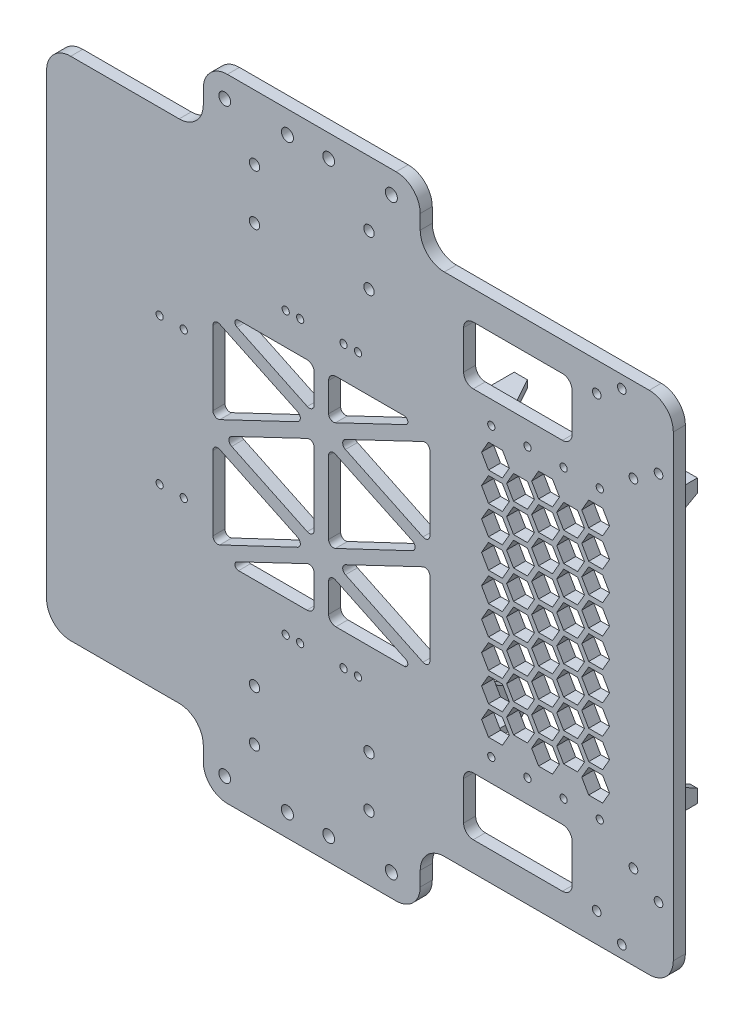
from build123d import *

# Parameters (mm, degrees)
EXTRUDE_1_DEPTH       = 5
EXTRUDE_2_DEPTH       = 20
CUT_EXTRUDE_3_DEPTH   = 10
CUT_EXTRUDE_4_DEPTH   = 10
MIRROR_2_COPY_1_DEPTH = 20
MIRROR_2_COPY_2_DEPTH = 10
MIRROR_2_COPY_3_DEPTH = 10
MIRROR_2_COPY_4_DEPTH = 20
MIRROR_2_COPY_5_DEPTH = 10
MIRROR_2_COPY_6_DEPTH = 10
CUT_EXTRUDE_5_DEPTH   = 5
SKETCH_9_W            = 45
SKETCH_9_H            = 24
CUT_EXTRUDE_6_DEPTH   = 5
FILLET_1_R            = 4
FILLET_2_R            = 1.5
FILLET_3_R            = 2
FILLET_4_R            = 3
SKETCH_10_R           = 1.8
SKETCH_10_R_2         = 2.5
SKETCH_10_R_3         = 2.45
SKETCH_10_R_4         = 1.5
SKETCH_10_R_5         = 2.15
CUT_EXTRUDE_7_DEPTH   = 186.636742053


with BuildPart() as part:
    # 草图1 → 凸台-拉伸1 (new body)
    with BuildSketch(Plane.XY):
        with BuildLine():
            Line((-130, 95), (-130, -95))
            ThreePointArc((-130, -95), (-127.071067812, -102.071067812), (-120, -105))
            Line((-120, -105), (-75, -105))
            ThreePointArc((-75, -105), (-67.928932188, -107.928932188), (-65, -115))
            Line((-65, -115), (-65, -121))
            ThreePointArc((-65, -121), (-62.071067812, -128.071067812), (-55, -131))
            Line((-55, -131), (15, -131))
            ThreePointArc((15, -131), (22.071067812, -128.071067812), (25, -121))
            Line((25, -121), (25, -115))
            ThreePointArc((25, -115), (27.928932188, -107.928932188), (35, -105))
            Line((35, -105), (120, -105))
            ThreePointArc((120, -105), (127.071067812, -102.071067812), (130, -95))
            Line((130, -95), (130, 95))
            ThreePointArc((130, 95), (127.071067812, 102.071067812), (120, 105))
            Line((120, 105), (35, 105))
            ThreePointArc((35, 105), (27.928932188, 107.928932188), (25, 115))
            Line((25, 115), (25, 121))
            ThreePointArc((25, 121), (22.071067812, 128.071067812), (15, 131))
            Line((15, 131), (-55, 131))
            ThreePointArc((-55, 131), (-62.071067812, 128.071067812), (-65, 121))
            Line((-65, 121), (-65, 115))
            ThreePointArc((-65, 115), (-67.928932188, 107.928932188), (-75, 105))
            Line((-75, 105), (-120, 105))
            ThreePointArc((-120, 105), (-127.071067812, 102.071067812), (-130, 95))
        make_face()
    extrude(amount=EXTRUDE_1_DEPTH)

    # 草图4 → 凸台-拉伸2 (add)
    with BuildSketch(Plane(origin=(0, 0, 0), x_dir=(-1, 0, 0), z_dir=(0, 0, -1))):
        Polygon((-39, -47.5), (-39, -58.5), (-50, -58.5), (-50, -55.5), (-42, -55.5), (-42, -47.5), align=None)
    extrude_2 = extrude(amount=EXTRUDE_2_DEPTH)

    # 草图5 → 切除-拉伸3 (cut)
    with BuildSketch(Plane.XZ.offset(58.5)):
        Polygon((50, -10), (44.5, -20), (50, -20), align=None)
    cut_extrude_3 = extrude(amount=-CUT_EXTRUDE_3_DEPTH, mode=Mode.SUBTRACT)

    # 草图6 → 切除-拉伸4 (cut)
    with BuildSketch(Plane.ZY.offset(-39)):
        Polygon((-20, -53), (-10, -47.5), (-20, -47.5), align=None)
    cut_extrude_4 = extrude(amount=-CUT_EXTRUDE_4_DEPTH, mode=Mode.SUBTRACT)

    # 镜向1: 凸台-拉伸2, 切除-拉伸3, 切除-拉伸4 across plane
    add(extrude_2.mirror(Plane(origin=(77, 0, 0), x_dir=(0, 0, 1), z_dir=(1, 0, 0))))
    add(cut_extrude_3.mirror(Plane(origin=(77, 0, 0), x_dir=(0, 0, 1), z_dir=(1, 0, 0))), mode=Mode.SUBTRACT)
    add(cut_extrude_4.mirror(Plane(origin=(77, 0, 0), x_dir=(0, 0, 1), z_dir=(1, 0, 0))), mode=Mode.SUBTRACT)

    # 镜向2 copy 1 sketch → 镜向2 copy 1 (add)
    with BuildSketch(Plane(origin=(154, 0, 0), x_dir=(1, 0, 0), z_dir=(0, 0, -1))):
        Polygon((-39, -47.5), (-39, -58.5), (-50, -58.5), (-50, -55.5), (-42, -55.5), (-42, -47.5), align=None)
    extrude(amount=MIRROR_2_COPY_1_DEPTH)

    # 镜向2 copy 2 sketch → 镜向2 copy 2 (cut)
    with BuildSketch(Plane(origin=(154, 58.5, 0), x_dir=(-1, 0, 0), z_dir=(0, 1, 0))):
        Polygon((50, -10), (44.5, -20), (50, -20), align=None)
    extrude(amount=-MIRROR_2_COPY_2_DEPTH, mode=Mode.SUBTRACT)

    # 镜向2 copy 3 sketch → 镜向2 copy 3 (cut)
    with BuildSketch(Plane(origin=(115, 0, 0), x_dir=(0, 0, 1), z_dir=(1, 0, 0))):
        Polygon((-20, -53), (-10, -47.5), (-20, -47.5), align=None)
    extrude(amount=-MIRROR_2_COPY_3_DEPTH, mode=Mode.SUBTRACT)

    # 镜向2 copy 4 sketch → 镜向2 copy 4 (add)
    with BuildSketch(Plane(origin=(0, 0, 0), x_dir=(-1, 0, 0), z_dir=(0, 0, -1))):
        Polygon((-39, 47.5), (-39, 58.5), (-50, 58.5), (-50, 55.5), (-42, 55.5), (-42, 47.5), align=None)
    extrude(amount=MIRROR_2_COPY_4_DEPTH)

    # 镜向2 copy 5 sketch → 镜向2 copy 5 (cut)
    with BuildSketch(Plane(origin=(0, 58.5, 0), x_dir=(1, 0, 0), z_dir=(0, 1, 0))):
        Polygon((50, 10), (44.5, 20), (50, 20), align=None)
    extrude(amount=-MIRROR_2_COPY_5_DEPTH, mode=Mode.SUBTRACT)

    # 镜向2 copy 6 sketch → 镜向2 copy 6 (cut)
    with BuildSketch(Plane.ZY.offset(-39)):
        Polygon((-20, 53), (-10, 47.5), (-20, 47.5), align=None)
    extrude(amount=-MIRROR_2_COPY_6_DEPTH, mode=Mode.SUBTRACT)

    # 草图7 → 切除-拉伸5 (cut)
    with BuildSketch(Plane(origin=(0, 0, 0), x_dir=(-1, 0, 0), z_dir=(0, 0, -1))):
        Polygon((-92.012994616, 36), (-94.899745962, 41), (-100.673248654, 41), (-103.56, 36), (-100.673248654, 31), (-94.899745962, 31), align=None)
        Polygon((-74.115136271, 31), (-71.228384925, 36), (-74.115136271, 41), (-79.888638963, 41), (-82.775390309, 36), (-79.888638963, 31), align=None)
        Polygon((-92.012994616, 24), (-94.899745962, 29), (-100.673248654, 29), (-103.56, 24), (-100.673248654, 19), (-94.899745962, 19), align=None)
        Polygon((-93.167695155, 30), (-90.280943809, 25), (-84.507441117, 25), (-81.620689771, 30), (-84.507441117, 35), (-90.280943809, 35), align=None)
        Polygon((-84.507441117, 37), (-81.620689771, 42), (-84.507441117, 47), (-90.280943809, 47), (-93.167695155, 42), (-90.280943809, 37), align=None)
        Polygon((-79.888638963, 43), (-74.115136271, 43), (-71.228384925, 48), (-74.115136271, 53), (-79.888638963, 53), (-82.775390309, 48), align=None)
        Polygon((-94.899745962, 43), (-92.012994616, 48), (-94.899745962, 53), (-100.673248654, 53), (-103.56, 48), (-100.673248654, 43), align=None)
        Polygon((-72.383085464, 42), (-69.496334118, 37), (-63.722831426, 37), (-60.83608008, 42), (-63.722831426, 47), (-69.496334118, 47), align=None)
        Polygon((-93.167695155, 18), (-90.280943809, 13), (-84.507441117, 13), (-81.620689771, 18), (-84.507441117, 23), (-90.280943809, 23), align=None)
        Polygon((-74.115136271, 19), (-71.228384925, 24), (-74.115136271, 29), (-79.888638963, 29), (-82.775390309, 24), (-79.888638963, 19), align=None)
        Polygon((-72.383085464, 30), (-69.496334118, 25), (-63.722831426, 25), (-60.83608008, 30), (-63.722831426, 35), (-69.496334118, 35), align=None)
        Polygon((-92.012994616, 12), (-94.899745962, 17), (-100.673248654, 17), (-103.56, 12), (-100.673248654, 7), (-94.899745962, 7), align=None)
        Polygon((-93.167695155, 6), (-90.280943809, 1), (-84.507441117, 1), (-81.620689771, 6), (-84.507441117, 11), (-90.280943809, 11), align=None)
        Polygon((-74.115136271, 7), (-71.228384925, 12), (-74.115136271, 17), (-79.888638963, 17), (-82.775390309, 12), (-79.888638963, 7), align=None)
        Polygon((-72.383085464, 18), (-69.496334118, 13), (-63.722831426, 13), (-60.83608008, 18), (-63.722831426, 23), (-69.496334118, 23), align=None)
        Polygon((-92.012994616, 0), (-94.899745962, 5), (-100.673248654, 5), (-103.56, 0), (-100.673248654, -5), (-94.899745962, -5), align=None)
        Polygon((-93.167695155, -6), (-90.280943809, -11), (-84.507441117, -11), (-81.620689771, -6), (-84.507441117, -1), (-90.280943809, -1), align=None)
        Polygon((-74.115136271, -5), (-71.228384925, 0), (-74.115136271, 5), (-79.888638963, 5), (-82.775390309, 0), (-79.888638963, -5), align=None)
        Polygon((-72.383085464, 6), (-69.496334118, 1), (-63.722831426, 1), (-60.83608008, 6), (-63.722831426, 11), (-69.496334118, 11), align=None)
        Polygon((-92.012994616, -12), (-94.899745962, -7), (-100.673248654, -7), (-103.56, -12), (-100.673248654, -17), (-94.899745962, -17), align=None)
        Polygon((-93.167695155, -18), (-90.280943809, -23), (-84.507441117, -23), (-81.620689771, -18), (-84.507441117, -13), (-90.280943809, -13), align=None)
        Polygon((-74.115136271, -17), (-71.228384925, -12), (-74.115136271, -7), (-79.888638963, -7), (-82.775390309, -12), (-79.888638963, -17), align=None)
        Polygon((-72.383085464, -6), (-69.496334118, -11), (-63.722831426, -11), (-60.83608008, -6), (-63.722831426, -1), (-69.496334118, -1), align=None)
        Polygon((-92.012994616, -24), (-94.899745962, -19), (-100.673248654, -19), (-103.56, -24), (-100.673248654, -29), (-94.899745962, -29), align=None)
        Polygon((-93.167695155, -30), (-90.280943809, -35), (-84.507441117, -35), (-81.620689771, -30), (-84.507441117, -25), (-90.280943809, -25), align=None)
        Polygon((-74.115136271, -29), (-71.228384925, -24), (-74.115136271, -19), (-79.888638963, -19), (-82.775390309, -24), (-79.888638963, -29), align=None)
        Polygon((-72.383085464, -18), (-69.496334118, -23), (-63.722831426, -23), (-60.83608008, -18), (-63.722831426, -13), (-69.496334118, -13), align=None)
        Polygon((-92.012994616, -36), (-94.899745962, -31), (-100.673248654, -31), (-103.56, -36), (-100.673248654, -41), (-94.899745962, -41), align=None)
        Polygon((-93.167695155, -42), (-90.280943809, -47), (-84.507441117, -47), (-81.620689771, -42), (-84.507441117, -37), (-90.280943809, -37), align=None)
        Polygon((-74.115136271, -41), (-71.228384925, -36), (-74.115136271, -31), (-79.888638963, -31), (-82.775390309, -36), (-79.888638963, -41), align=None)
        Polygon((-72.383085464, -30), (-69.496334118, -35), (-63.722831426, -35), (-60.83608008, -30), (-63.722831426, -25), (-69.496334118, -25), align=None)
        Polygon((-92.012994616, -48), (-94.899745962, -43), (-100.673248654, -43), (-103.56, -48), (-100.673248654, -53), (-94.899745962, -53), align=None)
        Polygon((-74.115136271, -53), (-71.228384925, -48), (-74.115136271, -43), (-79.888638963, -43), (-82.775390309, -48), (-79.888638963, -53), align=None)
        Polygon((-72.383085464, -42), (-69.496334118, -47), (-63.722831426, -47), (-60.83608008, -42), (-63.722831426, -37), (-69.496334118, -37), align=None)
        Polygon((-61.990780618, 36), (-59.104029272, 31), (-53.330526581, 31), (-50.443775235, 36), (-53.330526581, 41), (-59.104029272, 41), align=None)
        Polygon((-61.990780618, 48), (-59.104029272, 43), (-53.330526581, 43), (-50.443775235, 48), (-53.330526581, 53), (-59.104029272, 53), align=None)
        Polygon((-61.990780618, 24), (-59.104029272, 19), (-53.330526581, 19), (-50.443775235, 24), (-53.330526581, 29), (-59.104029272, 29), align=None)
        Polygon((-61.990780618, 12), (-59.104029272, 7), (-53.330526581, 7), (-50.443775235, 12), (-53.330526581, 17), (-59.104029272, 17), align=None)
        Polygon((-61.990780618, 0), (-59.104029272, -5), (-53.330526581, -5), (-50.443775235, 0), (-53.330526581, 5), (-59.104029272, 5), align=None)
        Polygon((-61.990780618, -12), (-59.104029272, -17), (-53.330526581, -17), (-50.443775235, -12), (-53.330526581, -7), (-59.104029272, -7), align=None)
        Polygon((-61.990780618, -24), (-59.104029272, -29), (-53.330526581, -29), (-50.443775235, -24), (-53.330526581, -19), (-59.104029272, -19), align=None)
        Polygon((-61.990780618, -36), (-59.104029272, -41), (-53.330526581, -41), (-50.443775235, -36), (-53.330526581, -31), (-59.104029272, -31), align=None)
        Polygon((-61.990780618, -48), (-59.104029272, -53), (-53.330526581, -53), (-50.443775235, -48), (-53.330526581, -43), (-59.104029272, -43), align=None)
    extrude(amount=-CUT_EXTRUDE_5_DEPTH, mode=Mode.SUBTRACT)

    # 草图9 → 切除-拉伸6 (cut)
    with BuildSketch(Plane(origin=(0, 0, 0), x_dir=(-1, 0, 0), z_dir=(0, 0, -1))):
        Polygon((9.804878049, 22.5), (-29, 41), (-29, 4), align=None)
        Polygon((13, -26.88372093), (-25, -45), (13, -45), align=None)
        Polygon((22.074593576, -22.557461202), (61, -41), (61, -4), align=None)
        Polygon((19, 26.88372093), (57, 45), (19, 45), align=None)
        Polygon((19, -18.11627907), (57, 0), (19, 18.11627907), align=None)
        with Locations((-65.5, 81)):
            Rectangle(SKETCH_9_W, SKETCH_9_H)
        with Locations((-65.5, -81)):
            Rectangle(SKETCH_9_W, SKETCH_9_H)
        Polygon((13, 45), (-25, 45), (13, 26.88372093), align=None)
        Polygon((61, 4), (61, 41), (22.074593576, 22.557461202), align=None)
        Polygon((13, 18.257993079), (-25.535898385, 0), (13, -18.257993079), align=None)
        Polygon((19, -45), (57, -45), (19, -26.88372093), align=None)
        Polygon((-29, -41), (9.804878049, -22.5), (-29, -4), align=None)
    extrude(amount=-CUT_EXTRUDE_6_DEPTH, mode=Mode.SUBTRACT)

    # 圆角1
    fillet_1_edges = [part.edges().sort_by_distance(p)[0] for p in [
        (43, -93, 2.5),
        (88, -69, 2.5),
        (43, -69, 2.5),
        (88, -93, 2.5),
        (88, 69, 2.5),
        (43, 69, 2.5),
        (43, 93, 2.5),
        (88, 93, 2.5),
    ]]
    fillet(fillet_1_edges, radius=FILLET_1_R)

    # 圆角2
    fillet_2_edges = [part.edges().sort_by_distance(p)[0] for p in [
        (25, -45, 2.5),
        (-57, -45, 2.5),
        (25, 45, 2.5),
        (-57, 45, 2.5),
    ]]
    fillet(fillet_2_edges, radius=FILLET_2_R)

    # 圆角3
    fillet_3_edges = [part.edges().sort_by_distance(p)[0] for p in [
        (29, -4, 2.5),
        (29, 4, 2.5),
        (-13, -18.257993079, 2.5),
        (-61, -41, 2.5),
        (-61, 4, 2.5),
        (-13, -26.88372093, 2.5),
        (-13, 18.257993079, 2.5),
        (-61, -4, 2.5),
        (-22.074593576, -22.557461202, 2.5),
        (25.535898385, 0, 2.5),
        (-22.074593576, 22.557461202, 2.5),
        (-61, 41, 2.5),
        (-19, 26.88372093, 2.5),
        (-19, -26.88372093, 2.5),
        (-19, -18.11627907, 2.5),
        (29, -41, 2.5),
        (29, 41, 2.5),
        (-57, 0, 2.5),
        (-9.804878049, -22.5, 2.5),
        (-13, 26.88372093, 2.5),
        (-9.804878049, 22.5, 2.5),
        (-19, 18.11627907, 2.5),
    ]]
    fillet(fillet_3_edges, radius=FILLET_3_R)

    # 圆角4
    fillet_4_edges = [part.edges().sort_by_distance(p)[0] for p in [
        (-13, -45, 2.5),
        (-13, 45, 2.5),
        (-19, -45, 2.5),
        (-19, 45, 2.5),
    ]]
    fillet(fillet_4_edges, radius=FILLET_4_R)

    # 草图10 → 切除-拉伸7 (cut, through all)
    with BuildSketch(Plane(origin=(0, 0, 0), x_dir=(-1, 0, 0), z_dir=(0, 0, -1))):
        with Locations((-123.874270778, 76.959685144)):
            Circle(SKETCH_10_R)
        with Locations((-113.46869275, 70.033362462)):
            Circle(SKETCH_10_R)
        with Locations((-108.636360878, 99.851956806)):
            Circle(SKETCH_10_R)
        with Locations((-98.23078285, 92.925634125)):
            Circle(SKETCH_10_R)
        with Locations((-13.026746603, 121.678975654)):
            Circle(SKETCH_10_R_2)
        with Locations((56.094087389, 121.678975654)):
            Circle(SKETCH_10_R_3)
        with Locations((30.094087389, 121.678975654)):
            Circle(SKETCH_10_R_2)
        with Locations((12.973253397, 121.678975654)):
            Circle(SKETCH_10_R_3)
        with Locations((12.973253397, -121.678975654)):
            Circle(SKETCH_10_R_3)
        with Locations((30.094087389, -121.678975654)):
            Circle(SKETCH_10_R_2)
        with Locations((56.094087389, -121.678975654)):
            Circle(SKETCH_10_R_3)
        with Locations((-13.026746603, -121.678975654)):
            Circle(SKETCH_10_R_2)
        with Locations((-98.23078285, -92.925634125)):
            Circle(SKETCH_10_R)
        with Locations((-108.636360878, -99.851956806)):
            Circle(SKETCH_10_R)
        with Locations((-113.46869275, -70.033362462)):
            Circle(SKETCH_10_R)
        with Locations((-123.874270778, -76.959685144)):
            Circle(SKETCH_10_R)
        with Locations((-99.5, 59.5)):
            Circle(SKETCH_10_R_4)
        with Locations((-84.5, 59.5)):
            Circle(SKETCH_10_R_4)
        with Locations((-69.5, 59.5)):
            Circle(SKETCH_10_R_4)
        with Locations((-54.5, 59.5)):
            Circle(SKETCH_10_R_4)
        with Locations((0.806057342, 58.25)):
            Circle(SKETCH_10_R_4)
        with Locations((6.806057342, 58.25)):
            Circle(SKETCH_10_R_4)
        with Locations((24.806057342, 58.25)):
            Circle(SKETCH_10_R_4)
        with Locations((30.806057342, 58.25)):
            Circle(SKETCH_10_R_4)
        with Locations((30.806057342, -58.25)):
            Circle(SKETCH_10_R_4)
        with Locations((24.806057342, -58.25)):
            Circle(SKETCH_10_R_4)
        with Locations((6.806057342, -58.25)):
            Circle(SKETCH_10_R_4)
        with Locations((0.806057342, -58.25)):
            Circle(SKETCH_10_R_4)
        with Locations((-54.5, -59.5)):
            Circle(SKETCH_10_R_4)
        with Locations((-69.5, -59.5)):
            Circle(SKETCH_10_R_4)
        with Locations((-84.5, -59.5)):
            Circle(SKETCH_10_R_4)
        with Locations((-99.5, -59.5)):
            Circle(SKETCH_10_R_4)
        with Locations((73.101514825, 30.3)):
            Circle(SKETCH_10_R_4)
        with Locations((83.101514825, 30.3)):
            Circle(SKETCH_10_R_4)
        with Locations((83.101514825, -30.3)):
            Circle(SKETCH_10_R_4)
        with Locations((73.101514825, -30.3)):
            Circle(SKETCH_10_R_4)
        with Locations((43.75, 83.16647484)):
            Circle(SKETCH_10_R_5)
        with Locations((43.75, 104.16647484)):
            Circle(SKETCH_10_R_5)
        with Locations((-3.75, 83.16647484)):
            Circle(SKETCH_10_R_5)
        with Locations((-3.75, 104.16647484)):
            Circle(SKETCH_10_R_5)
        with Locations((-3.75, -104.16647484)):
            Circle(SKETCH_10_R_5)
        with Locations((-3.75, -83.16647484)):
            Circle(SKETCH_10_R_5)
        with Locations((43.75, -104.16647484)):
            Circle(SKETCH_10_R_5)
        with Locations((43.75, -83.16647484)):
            Circle(SKETCH_10_R_5)
    extrude(amount=-CUT_EXTRUDE_7_DEPTH, mode=Mode.SUBTRACT)


solid = part.part
